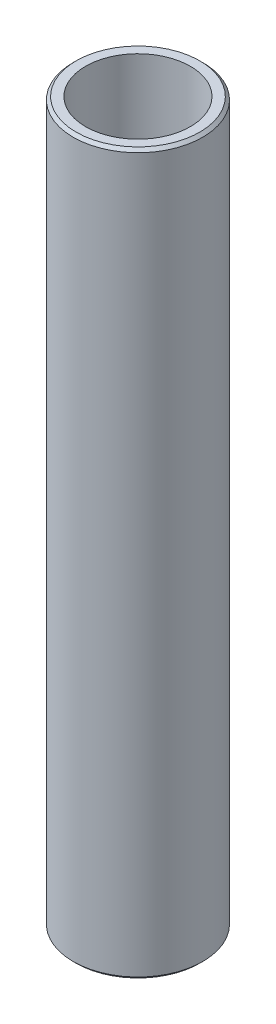
from build123d import *

# Parameters (mm, degrees)
SKETCH1_R           = 32.5
BOSS_EXTRUDE1_DEPTH = 361.180381513
SKETCH2_R           = 26.283335644
CUT_EXTRUDE1_DEPTH  = 365.093075998
CHAMFER1_SIZE       = 1.484820435


with BuildPart() as part:
    # Sketch1 → Boss-Extrude1 (new body)
    with BuildSketch(Plane(origin=(0, 0, 0), x_dir=(1, 0, 0), z_dir=(0, 1, 0))):
        Circle(SKETCH1_R)
    extrude(amount=BOSS_EXTRUDE1_DEPTH)

    # Sketch2 → Cut-Extrude1 (cut, through all)
    with BuildSketch(Plane(origin=(0, 0, 0), x_dir=(1, 0, 0), z_dir=(0, 1, 0))):
        Circle(SKETCH2_R)
    extrude(amount=CUT_EXTRUDE1_DEPTH, mode=Mode.SUBTRACT)

    # Chamfer1
    chamfer1_edges = [part.edges().sort_by_distance(p)[0] for p in [
        (-32.5, 361.180381513, 0),
        (-32.5, 0, 0),
    ]]
    chamfer(chamfer1_edges, length=CHAMFER1_SIZE)


solid = part.part
